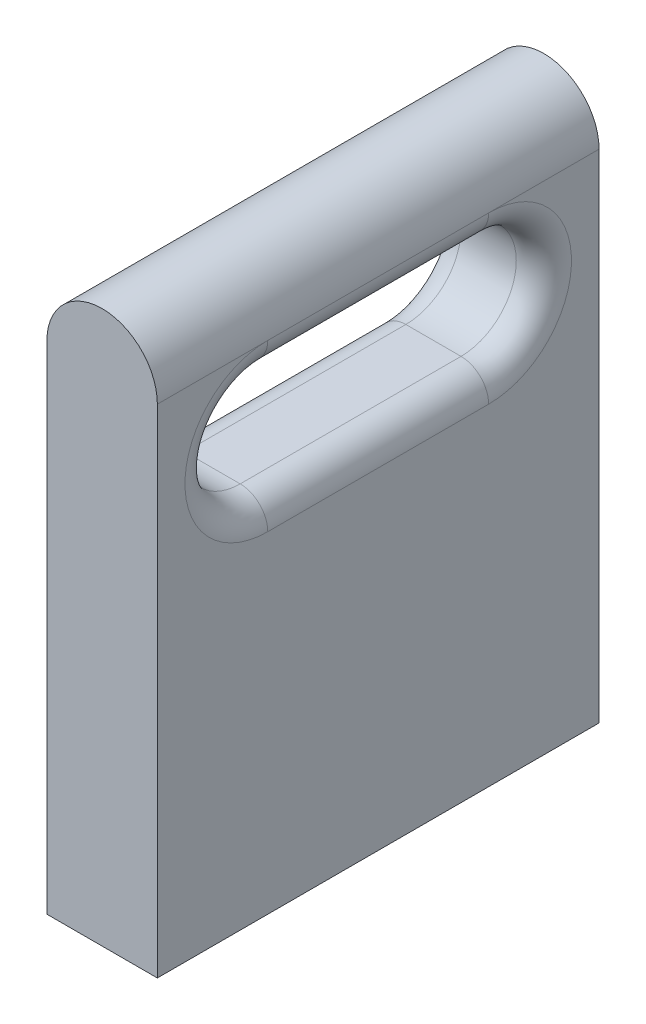
from build123d import *

# Parameters (mm, degrees)
BOSS_EXTRUDE1_DEPTH     = 101.6
CUT_EXTRUDE1_DEPTH      = 165.61081374
CUT_EXTRUDE1_DEPTH_BACK = 165.61081374
FILLET6_R               = 6.35
FILLET7_R               = 6.35


with BuildPart() as part:
    # Sketch1 → Boss-Extrude1 (new body)
    with BuildSketch(Plane.XY):
        with BuildLine():
            Line((0, 0), (25.4, 0))
            Line((25.4, 0), (25.4, 114.3))
            ThreePointArc((25.4, 114.3), (12.7, 127), (0, 114.3))
            Line((0, 114.3), (0, 0))
        make_face()
    extrude(amount=BOSS_EXTRUDE1_DEPTH)

    # Sketch2 → Cut-Extrude1 (cut, two sides: drawn at the far end of the back side and taken through both)
    with BuildSketch(Plane(origin=(25.4, 0, 0), x_dir=(0, 0, -1), z_dir=(1, 0, 0)).offset(-CUT_EXTRUDE1_DEPTH_BACK)):
        with BuildLine():
            Line((-76.2, 107.95), (-25.4, 107.95))
            ThreePointArc((-25.4, 107.95), (-12.7, 95.25), (-25.4, 82.55))
            Line((-25.4, 82.55), (-76.2, 82.55))
            ThreePointArc((-76.2, 82.55), (-88.9, 95.25), (-76.2, 107.95))
        make_face()
    extrude(amount=CUT_EXTRUDE1_DEPTH + CUT_EXTRUDE1_DEPTH_BACK, mode=Mode.SUBTRACT)

    # Fillet6
    fillet6_edges = [part.edges().sort_by_distance(p)[0] for p in [
        (0, 95.25, 88.9),
        (0, 95.25, 12.7),
        (0, 82.55, 50.8),
        (0, 107.95, 50.8),
    ]]
    fillet(fillet6_edges, radius=FILLET6_R - 0.0001)  # a hair under: the kernel refuses the full size

    # Fillet7
    fillet7_edges = [part.edges().sort_by_distance(p)[0] for p in [
        (25.4, 82.55, 50.8),
        (25.4, 95.25, 12.7),
        (25.4, 107.95, 50.8),
        (25.4, 95.25, 88.9),
    ]]
    fillet(fillet7_edges, radius=FILLET7_R - 0.0001)  # a hair under: the kernel refuses the full size


solid = part.part
